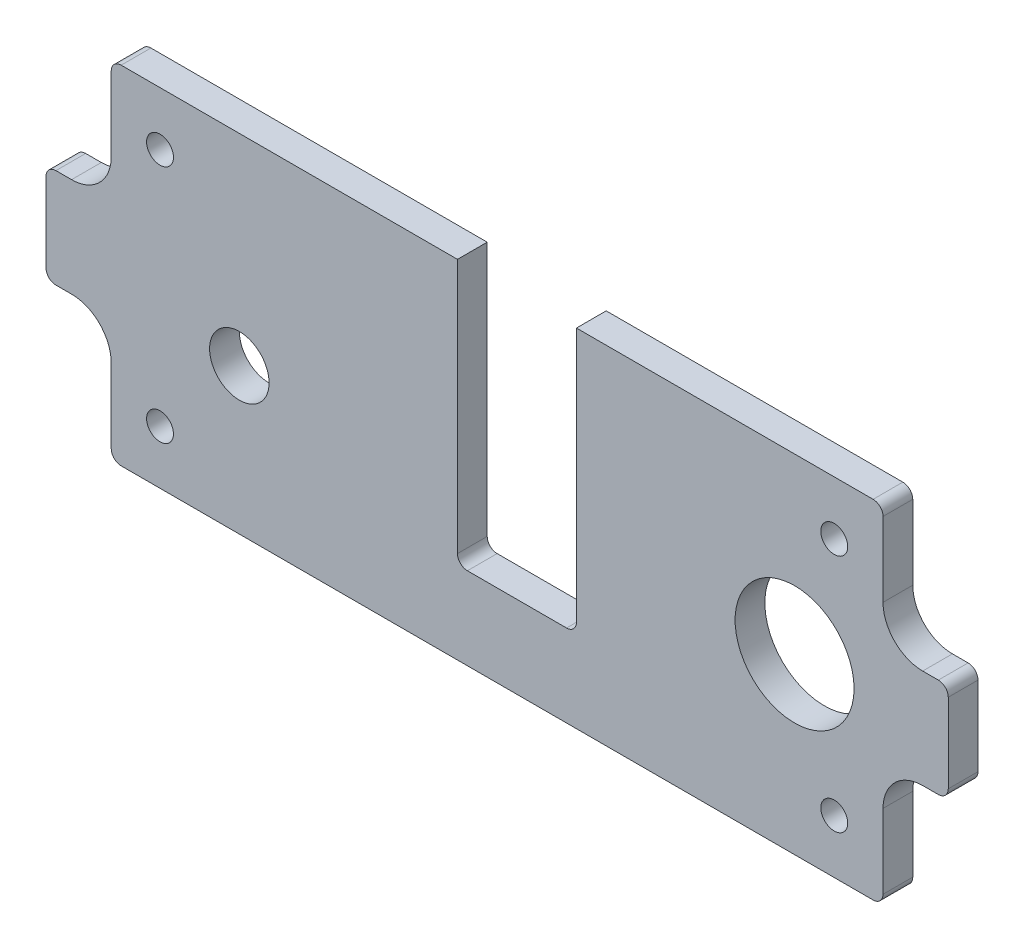
from build123d import *

# Parameters (mm, degrees)
BOSS_EXTRUDE1_DEPTH          = 4.7625
F_3_8_0_375_DIAMETER_HOLE1_D = 9.525
F_3_4_0_75_DIAMETER_HOLE1_D  = 19.05
F_6_CLEARANCE_HOLE1_D        = 4.3053
FILLET1_R                    = 1.5875


with BuildPart() as part:
    # Sketch1 → Boss-Extrude1 (new body)
    with BuildSketch(Plane.XY):
        with BuildLine():
            Line((85.725, 56.35625), (85.725, 13.97))
            Line((85.725, 13.97), (66.675, 13.97))
            Line((66.675, 13.97), (66.675, 56.35625))
            Line((66.675, 56.35625), (11.2395, 56.35625))
            Line((11.2395, 56.35625), (11.2395, 42.8625))
            ThreePointArc((11.2395, 42.8625), (9.379628061, 38.372371939), (4.8895, 36.5125))
            Line((4.8895, 36.5125), (0.79375, 36.5125))
            Line((0.79375, 36.5125), (0.79375, 20.6375))
            Line((0.79375, 20.6375), (4.8895, 20.6375))
            ThreePointArc((4.8895, 20.6375), (9.379628061, 18.777628061), (11.2395, 14.2875))
            Line((11.2395, 14.2875), (11.2395, 0.79375))
            Line((11.2395, 0.79375), (134.8105, 0.79375))
            Line((134.8105, 0.79375), (134.8105, 14.2875))
            ThreePointArc((134.8105, 14.2875), (136.670371939, 18.777628061), (141.1605, 20.6375))
            Line((141.1605, 20.6375), (145.25625, 20.6375))
            Line((145.25625, 20.6375), (145.25625, 36.5125))
            Line((145.25625, 36.5125), (141.1605, 36.5125))
            ThreePointArc((141.1605, 36.5125), (136.670371939, 38.372371939), (134.8105, 42.8625))
            Line((134.8105, 42.8625), (134.8105, 56.35625))
            Line((134.8105, 56.35625), (85.725, 56.35625))
        make_face()
    extrude(amount=BOSS_EXTRUDE1_DEPTH)

    # 3/8 (0.375) Diameter Hole1 (through all)
    with Locations(Plane.XY.offset(4.7625)):
        with Locations((31.75, 24.13)):
            Hole(F_3_8_0_375_DIAMETER_HOLE1_D / 2)

    # 3/4 (0.75) Diameter Hole1 (through all)
    with Locations(Plane.XY.offset(4.7625)):
        with Locations((76.2, 28.575), (120.65, 28.575)):
            Hole(F_3_4_0_75_DIAMETER_HOLE1_D / 2)

    # #6 Clearance Hole1 (through all)
    with Locations(Plane.XY.offset(4.7625)):
        with Locations((19.05, 9.398), (19.05, 47.752), (127, 47.752), (127, 9.398)):
            Hole(F_6_CLEARANCE_HOLE1_D / 2)

    # Fillet1
    fillet1_edges = [part.edges().sort_by_distance(p)[0] for p in [
        (66.675, 13.97, 2.38125),
        (85.725, 13.97, 2.38125),
        (134.8105, 56.35625, 2.38125),
        (145.25625, 36.5125, 2.38125),
        (145.25625, 20.6375, 2.38125),
        (134.8105, 0.79375, 2.38125),
        (11.2395, 56.35625, 2.38125),
        (0.79375, 36.5125, 2.38125),
        (0.79375, 20.6375, 2.38125),
        (11.2395, 0.79375, 2.38125),
    ]]
    fillet(fillet1_edges, radius=FILLET1_R)


solid = part.part
